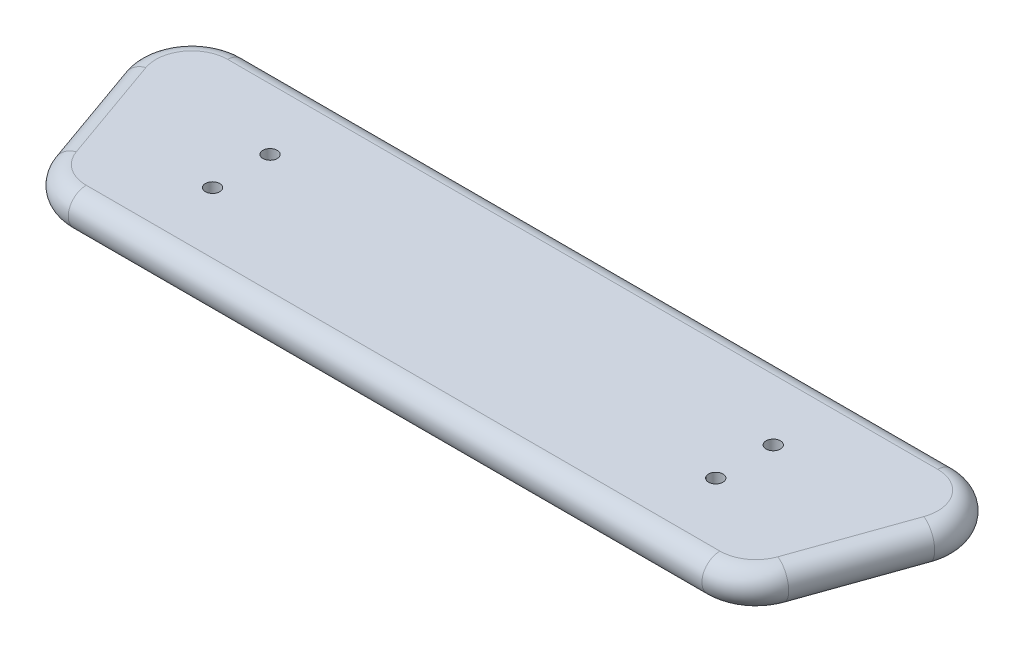
from build123d import *

# Parameters (mm, degrees)
BOSS_EXTRUDE1_DEPTH = 10
FILLET1_R           = 5
CUT_EXTRUDE7_START  = -2
SKETCH5_R           = 2
CUT_EXTRUDE7_DEPTH  = 8


with BuildPart() as part:
    # Sketch1 → Boss-Extrude1 (new body)
    with BuildSketch(Plane(origin=(0, 0, 0), x_dir=(1, 0, 0), z_dir=(0, 1, 0))):
        with BuildLine():
            Line((-112.915113285, 15), (-102.291556109, -15))
            ThreePointArc((-102.291556109, -15), (-96.809111593, -22.242520439), (-88.151933742, -24.992897111))
            Line((-88.151933742, -24.992897111), (88.151933742, -24.992897111))
            ThreePointArc((88.151933742, -24.992897111), (96.809111593, -22.242520439), (102.291556109, -15))
            Line((102.291556109, -15), (112.915113285, 15))
            ThreePointArc((112.915113285, 15), (111.025114246, 28.664280739), (98.775490918, 35.007102889))
            Line((98.775490918, 35.007102889), (-98.775490918, 35.007102889))
            ThreePointArc((-98.775490918, 35.007102889), (-111.025114246, 28.664280739), (-112.915113285, 15))
        make_face()
    extrude(amount=BOSS_EXTRUDE1_DEPTH)

    # Fillet1
    fillet1_edges = [part.edges().sort_by_distance(p)[0] for p in [
        (0, 0, -35.007102889),
        (111.025114246, 0, -28.664280739),
        (107.603334697, 0, 0),
        (96.809111593, 0, 22.242520439),
        (0, 10, -35.007102889),
        (-111.025114246, 10, -28.664280739),
        (-107.603334697, 10, 0),
        (-96.809111593, 10, 22.242520439),
        (0, 10, 24.992897111),
        (0, 0, 24.992897111),
        (107.603334697, 10, 0),
        (-107.603334697, 0, 0),
    ]]
    fillet(fillet1_edges, radius=FILLET1_R - 0.0001)  # a hair under: the kernel refuses the full size

    # Sketch5 → Cut-Extrude7 (cut)
    with BuildSketch(Plane.XZ.offset(CUT_EXTRUDE7_START)):
        with Locations(Location((-70, 2.992897111, 0), (0, 0, 270))):
            Circle(SKETCH5_R)
        with Locations(Location((-70, -13.007102889, 0), (0, 0, 90))):
            Circle(SKETCH5_R)
        with Locations(Location((70, -13.007102889, 0), (0, 0, 270))):
            Circle(SKETCH5_R)
        with Locations(Location((70, 2.992897111, 0), (0, 0, 90))):
            Circle(SKETCH5_R)
    extrude(amount=-CUT_EXTRUDE7_DEPTH, mode=Mode.SUBTRACT)


solid = part.part
